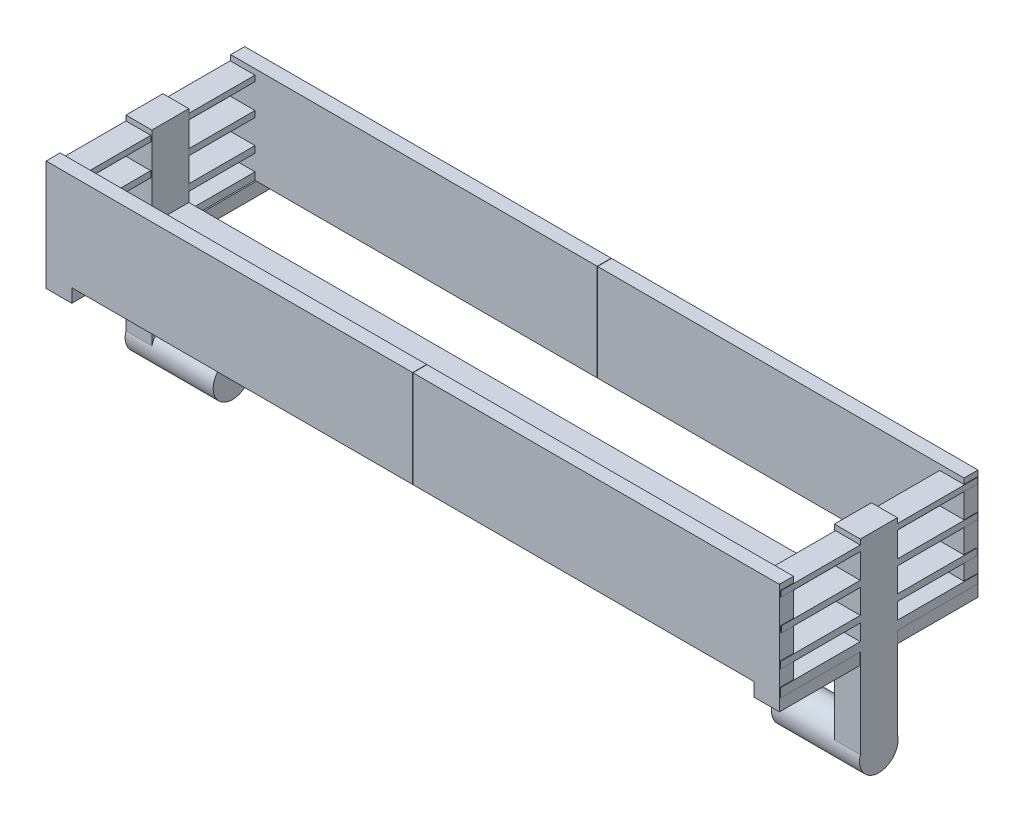
from build123d import *

# Parameters (mm, degrees)
BOSS_EXTRUDE1_DEPTH     = 17.78
BOSS_EXTRUDE2_START     = -0.254
BOSS_EXTRUDE2_DEPTH     = 24.638
BOSS_EXTRUDE3_START     = 328.253907246
BOSS_EXTRUDE3_OUTLINE_R = 18.542
BOSS_EXTRUDE3_DEPTH     = 84.582
CUT_EXTRUDE1_DEPTH      = 528.32
BOSS_EXTRUDE4_DEPTH     = 352.044
BOSS_EXTRUDE5_DEPTH     = 23.876


# Read off the part's stored shape, not the designer's step: Boss-Extrude3
with BuildPart() as part:
    # Sketch2 → Boss-Extrude1 (new, symmetric)
    with BuildSketch(Plane.XY):
        Polygon((60.124054664, 27.308389094), (387.937750572, 27.308389094), (387.937750572, -52.701610906), (412.835907246, -52.701610906), (412.835907246, 175.898389094), (387.937750572, 175.898389094), (387.937750572, 54.067255535), (60.124054664, 54.067255535), align=None)
    boss_extrude1 = extrude(amount=BOSS_EXTRUDE1_DEPTH, both=True)

    # 3DSketch1 → Boss-Extrude2 (add)
    with BuildSketch(Plane(origin=(387.937750572, 26.636606535, -0.300092304), x_dir=(1.1522480113550012e-15, 0.13508458090011558, -0.9908340708731408), z_dir=(1, 0, 0)).offset(BOSS_EXTRUDE2_START)):
        Polygon((0, 0), (94.376945251, -12.866806331), (96.35278288, 0), (-92.6187147, 25.763279951), (-94.376945251, 12.866806331), align=None)
    boss_extrude2 = extrude(amount=BOSS_EXTRUDE2_DEPTH)

    # Boss-Extrude3 outline → Boss-Extrude3 (add)
    with BuildSketch(Plane.YZ.offset(BOSS_EXTRUDE3_START)):
        with Locations((-52.701610906, 0)):
            Circle(BOSS_EXTRUDE3_OUTLINE_R)
    boss_extrude3 = extrude(amount=BOSS_EXTRUDE3_DEPTH)

    # 3DSketch4 → Cut-Extrude1 (cut)
    with BuildSketch(Plane(origin=(0, 190.54505023, 39.190913927), x_dir=(0, -0.6094247818041636, -0.7928438908908536), z_dir=(1, 0, 0))):
        Polygon((0, 0), (35.626268271, -46.348737362), (95.924625616, 0), (60.298357345, 46.348737362), align=None)
    cut_extrude1 = extrude(amount=CUT_EXTRUDE1_DEPTH, mode=Mode.SUBTRACT)

    # 3DSketch5 → Boss-Extrude4 (add)
    with BuildSketch(Plane(origin=(412.321750572, 39.652381829, 94.949907696), x_dir=(-2.6167454914043564e-15, 0.43787667160404403, -0.8990350496309719), z_dir=(1, 0, 0))):
        Polygon((0, 0), (12.114414059, -5.90034761), (52.872430981, 77.782771729), (40.758016921, 83.683119339), align=None)
        Polygon((171.463623123, -83.51167246), (159.39348064, -77.632887402), (200.067994044, 5.878785058), (212.138136527, 0), align=None)
    boss_extrude4 = extrude(amount=-BOSS_EXTRUDE4_DEPTH)

    # 3DSketch7 → Boss-Extrude5 (add)
    with BuildSketch(Plane(origin=(412.835907246, 127.168007467, 93.951567648), x_dir=(0, -0.42593081119403703, -0.9047557372438098), z_dir=(-1, 0, 0))):
        Polygon((0, 0), (170.799989129, -80.407313186), (173.103686862, -75.513833574), (2.303697733, 4.893479612), align=None)
        Polygon((12.745412392, 26.488926133), (183.181513062, -53.747079705), (185.685532337, -48.428080127), (15.249431667, 31.807925711), align=None)
        Polygon((24.392670249, 53.234916651), (195.324303783, -27.234370619), (198.0286446, -21.489851074), (27.097011066, 58.979436196), align=None)
        Polygon((33.959043019, 72.903233879), (205.08887574, -7.659359393), (208.694663496, 0), (37.564830775, 80.562593273), align=None)
    boss_extrude5 = extrude(amount=BOSS_EXTRUDE5_DEPTH)

    # Mirror5: Boss-Extrude1, Boss-Extrude2, Boss-Extrude3, Cut-Extrude1, Boss-Extrude4, Boss-Extrude5 across plane
    add(boss_extrude1.mirror(Plane.ZY.offset(-60.124054664)))
    add(boss_extrude2.mirror(Plane.ZY.offset(-60.124054664)))
    add(boss_extrude3.mirror(Plane.ZY.offset(-60.124054664)))
    add(cut_extrude1.mirror(Plane.ZY.offset(-60.124054664)), mode=Mode.SUBTRACT)
    add(boss_extrude4.mirror(Plane.ZY.offset(-60.124054664)))
    add(boss_extrude5.mirror(Plane.ZY.offset(-60.124054664)))


solid = part.part
